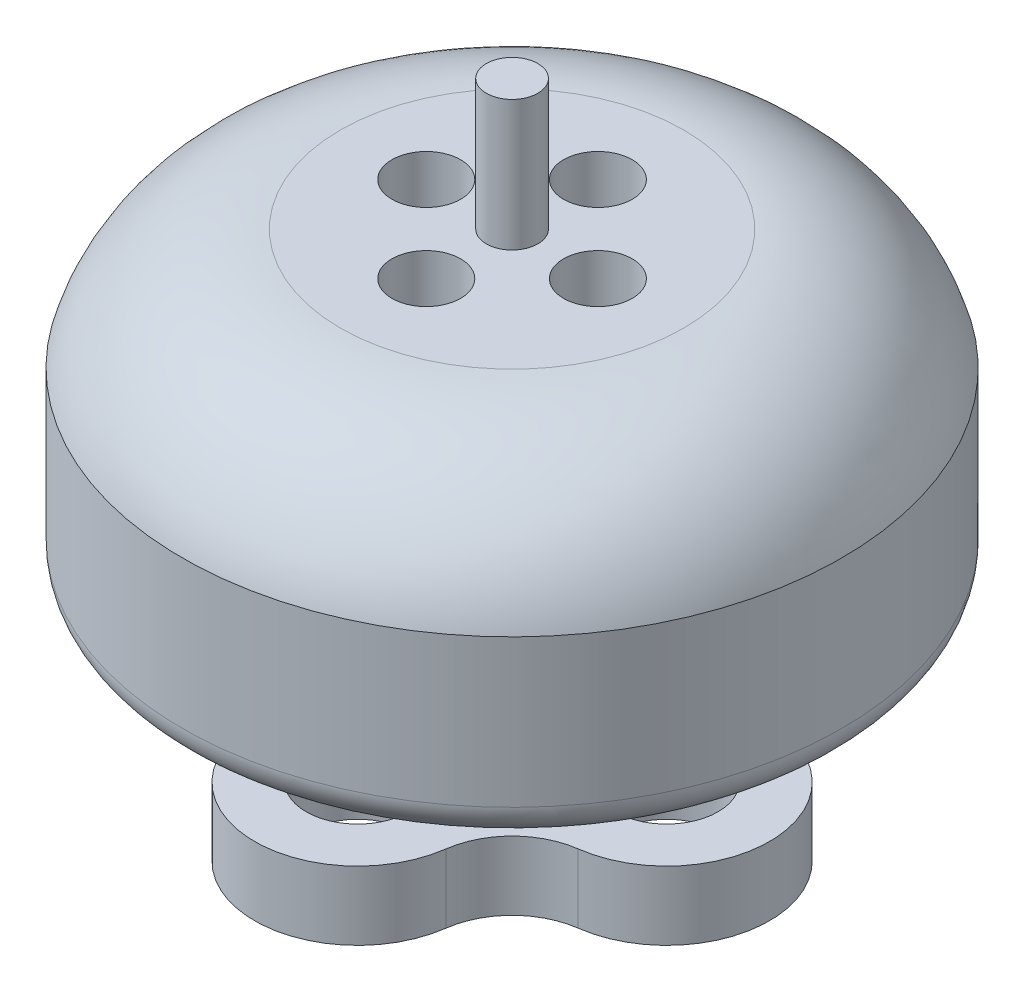
from build123d import *

# Parameters (mm, degrees)
REVOLVE_START       = -5.4
REVOLVE_4_OUTLINE_R = 0.75
REVOLVE_4_DEPTH     = 0.5
SKETCH_6_R          = 1.5
EXTRUDE_2_DEPTH     = 2
FILLET_2_R          = 1
SKETCH_8_R          = 1.5
CUT_EXTRUDE_1_DEPTH = 3
SKETCH_10_R         = 1
CUT_EXTRUDE_2_DEPTH = 3


with BuildPart() as part:
    # 旋转4: read off the stored shape, not the designer's step
    # 旋转4 outline → 旋转4 (new body)
    with BuildSketch(Plane(origin=(0, 0, 0), x_dir=(1, 0, 0), z_dir=(0, 1, 0)).offset(REVOLVE_START)):
        Circle(REVOLVE_4_OUTLINE_R)
    extrude(amount=REVOLVE_4_DEPTH)


with BuildPart() as body_2:
    # Revolve 4 2 outline → Revolve 4 2 (revolve)
    with BuildSketch(Plane.XY):
        with BuildLine():
            Line((9.6, 0), (9.6, 5.3))
            ThreePointArc((9.6, 5.3), (7.890069203, 7.825519524), (5, 8.8))
            Line((5, 8.8), (0.75, 8.8))
            Line((0.75, 8.8), (0.75, 12.6))
            Line((0.75, 12.6), (0, 12.6))
            Line((0, 12.6), (0, -2.9))
            Line((0, -2.9), (4.3, -2.9))
            ThreePointArc((4.3, -2.9), (3.380761184, -2.519238816), (3, -1.6))
            Line((3, -1.6), (3, 0))
            Line((3, 0), (9.6, 0))
        make_face()
    revolve(axis=Axis((0, 0, 0), (0, 1, 0)))

    # 草图6 → 凸台-拉伸2 (add)
    with BuildSketch(Plane.XZ.offset(2.9)):
        with BuildLine():
            ThreePointArc((2.973202969, 4.900080125), (3.611133324, 3.611133324), (4.900080125, 2.973202969))
            ThreePointArc((4.900080125, 2.973202969), (7.5, 0), (4.900080125, -2.973202969))
            ThreePointArc((4.900080125, -2.973202969), (3.611133324, -3.611133324), (2.973202969, -4.900080125))
            ThreePointArc((2.973202969, -4.900080125), (0, -7.5), (-2.973202969, -4.900080125))
            ThreePointArc((-2.973202969, -4.900080125), (-3.611133324, -3.611133324), (-4.900080125, -2.973202969))
            ThreePointArc((-4.900080125, -2.973202969), (-7.5, 0), (-4.900080125, 2.973202969))
            ThreePointArc((-4.900080125, 2.973202969), (-3.611133324, 3.611133324), (-2.973202969, 4.900080125))
            ThreePointArc((-2.973202969, 4.900080125), (0, 7.5), (2.973202969, 4.900080125))
        make_face()
        with Locations(Location((0, 4.5, 0), (0, 0, 197.279727309))):
            Circle(SKETCH_6_R, mode=Mode.SUBTRACT)
        with Locations(Location((4.5, 0, 0), (0, 0, 107.279727309))):
            Circle(SKETCH_6_R, mode=Mode.SUBTRACT)
        with Locations(Location((0, -4.5, 0), (0, 0, 17.279727309))):
            Circle(SKETCH_6_R, mode=Mode.SUBTRACT)
        with Locations(Location((-4.5, 0, 0), (0, 0, 72.720272691))):
            Circle(SKETCH_6_R, mode=Mode.SUBTRACT)
    extrude(amount=EXTRUDE_2_DEPTH)

    # 圆角2
    fillet_2_edges = [body_2.edges().sort_by_distance(p)[0] for p in [
        (-9.6, 0, 0),
    ]]
    fillet(fillet_2_edges, radius=FILLET_2_R)

    # 草图8 → 切除-拉伸1 (cut)
    with BuildSketch(Plane.XZ.offset(4.9)):
        with Locations(Location((0, 4.5, 0), (0, 0, 197.279727309))):
            Circle(SKETCH_8_R)
        with Locations(Location((4.5, 0, 0), (0, 0, 107.279727309))):
            Circle(SKETCH_8_R)
        with Locations(Location((0, -4.5, 0), (0, 0, 100.161715408))):
            Circle(SKETCH_8_R)
        with Locations(Location((-4.5, 0, 0), (0, 0, 72.72027268))):
            Circle(SKETCH_8_R)
    extrude(amount=-CUT_EXTRUDE_1_DEPTH, mode=Mode.SUBTRACT)

    # 草图10 → 切除-拉伸2 (cut)
    with BuildSketch(Plane(origin=(0, 8.8, 0), x_dir=(1, 0, 0), z_dir=(0, 1, 0))):
        with Locations(Location((2.5, 0, 0), (0, 0, 270))):
            Circle(SKETCH_10_R)
        with Locations(Location((0, -2.5, 0), (0, 0, 270))):
            Circle(SKETCH_10_R)
        with Locations(Location((-2.5, 0, 0), (0, 0, 270))):
            Circle(SKETCH_10_R)
        with Locations(Location((0, 2.5, 0), (0, 0, 270))):
            Circle(SKETCH_10_R)
    extrude(amount=-CUT_EXTRUDE_2_DEPTH, mode=Mode.SUBTRACT)


solid = Compound([part.part, body_2.part])
